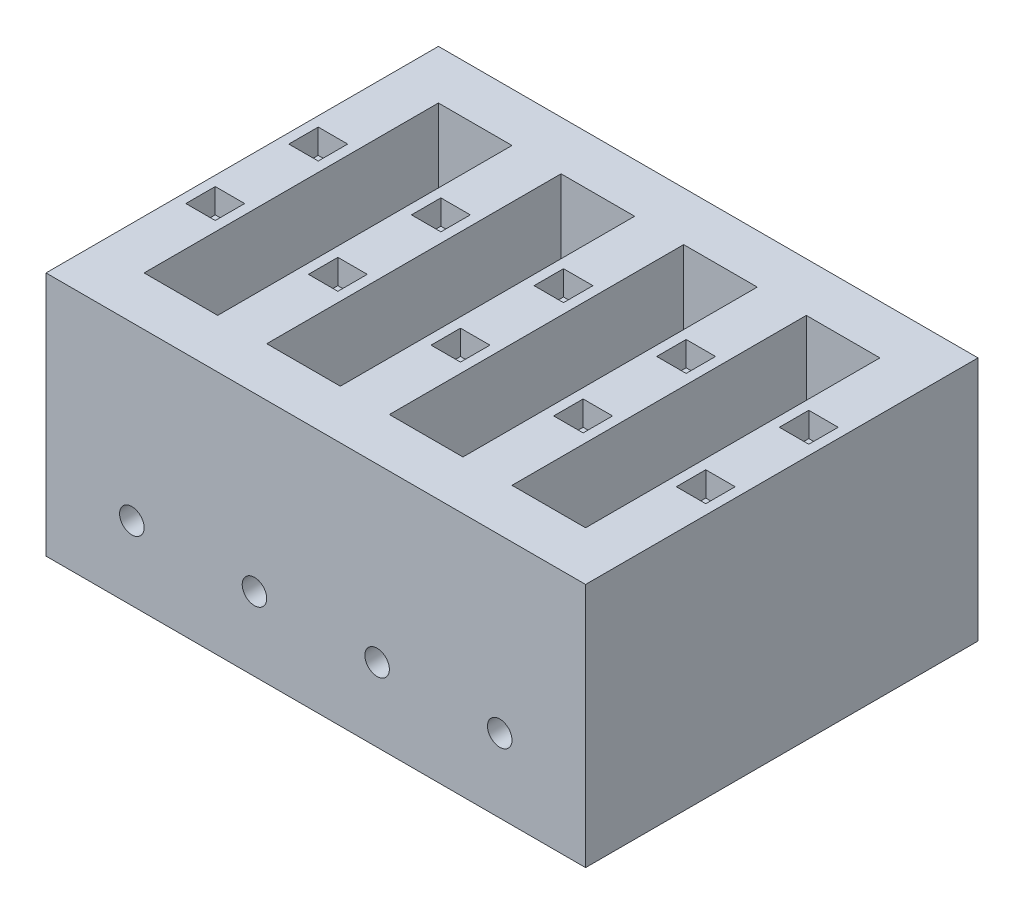
from build123d import *

# Parameters (mm, degrees)
SKETCH1_W           = 110
SKETCH1_H           = 50
BOSS_EXTRUDE1_DEPTH = 80
SKETCH2_W           = 15
SKETCH2_H           = 10
CUT_EXTRUDE1_DEPTH  = 40
SKETCH4_R           = 2.5
CUT_EXTRUDE2_DEPTH  = 10
SKETCH5_W           = 15
SKETCH5_H           = 40
CUT_EXTRUDE3_DEPTH  = 15
SKETCH6_W           = 6
SKETCH6_H           = 6
CUT_EXTRUDE4_DEPTH  = 5


with BuildPart() as part:
    # Sketch1 → Boss-Extrude1 (new body)
    with BuildSketch(Plane.XY):
        with Locations((55, 25)):
            Rectangle(SKETCH1_W, SKETCH1_H)
    extrude(amount=-BOSS_EXTRUDE1_DEPTH)

    # Sketch2 → Cut-Extrude1 (cut)
    with BuildSketch(Plane(origin=(0, 50, 0), x_dir=(1, 0, 0), z_dir=(0, 1, 0))):
        with Locations((17.5, 15)):
            Rectangle(SKETCH2_W, SKETCH2_H)
        with Locations((17.5, 65)):
            Rectangle(SKETCH2_W, SKETCH2_H)
        with Locations((42.5, 15)):
            Rectangle(SKETCH2_W, SKETCH2_H)
        with Locations((42.5, 65)):
            Rectangle(SKETCH2_W, SKETCH2_H)
        with Locations((67.5, 15)):
            Rectangle(SKETCH2_W, SKETCH2_H)
        with Locations((67.5, 65)):
            Rectangle(SKETCH2_W, SKETCH2_H)
        with Locations((92.5, 15)):
            Rectangle(SKETCH2_W, SKETCH2_H)
        with Locations((92.5, 65)):
            Rectangle(SKETCH2_W, SKETCH2_H)
    extrude(amount=-CUT_EXTRUDE1_DEPTH, mode=Mode.SUBTRACT)

    # Sketch4 → Cut-Extrude2 (cut)
    with BuildSketch(Plane.XY):
        with Locations((17.5, 15)):
            Circle(SKETCH4_R)
        with Locations((42.5, 15)):
            Circle(SKETCH4_R)
        with Locations((67.5, 15)):
            Circle(SKETCH4_R)
        with Locations((92.5, 15)):
            Circle(SKETCH4_R)
    cut_extrude2 = extrude(amount=-CUT_EXTRUDE2_DEPTH, mode=Mode.SUBTRACT)

    # Mirror1: Cut-Extrude2 across plane
    add(cut_extrude2.mirror(Plane.XY.offset(-40)), mode=Mode.SUBTRACT)

    # Sketch5 → Cut-Extrude3 (cut)
    with BuildSketch(Plane(origin=(0, 50, 0), x_dir=(1, 0, 0), z_dir=(0, 1, 0))):
        with Locations((42.5, 40)):
            Rectangle(SKETCH5_W, SKETCH5_H)
        with Locations((17.5, 40)):
            Rectangle(SKETCH5_W, SKETCH5_H)
        with Locations((67.5, 40)):
            Rectangle(SKETCH5_W, SKETCH5_H)
        with Locations((92.5, 40)):
            Rectangle(SKETCH5_W, SKETCH5_H)
    extrude(amount=-CUT_EXTRUDE3_DEPTH, mode=Mode.SUBTRACT)

    # Sketch6 → Cut-Extrude4 (cut)
    with BuildSketch(Plane(origin=(0, 50, 0), x_dir=(1, 0, 0), z_dir=(0, 1, 0))):
        with Locations((5, 50.5)):
            Rectangle(SKETCH6_W, SKETCH6_H)
        with Locations((30, 50.5)):
            Rectangle(SKETCH6_W, SKETCH6_H)
        with Locations((55, 50.5)):
            Rectangle(SKETCH6_W, SKETCH6_H)
        with Locations((80, 50.5)):
            Rectangle(SKETCH6_W, SKETCH6_H)
        with Locations((105, 50.5)):
            Rectangle(SKETCH6_W, SKETCH6_H)
        with Locations((30, 29.5)):
            Rectangle(SKETCH6_W, SKETCH6_H)
        with Locations((55, 29.5)):
            Rectangle(SKETCH6_W, SKETCH6_H)
        with Locations((80, 29.5)):
            Rectangle(SKETCH6_W, SKETCH6_H)
        with Locations((105, 29.5)):
            Rectangle(SKETCH6_W, SKETCH6_H)
        with Locations((5, 29.5)):
            Rectangle(SKETCH6_W, SKETCH6_H)
    extrude(amount=-CUT_EXTRUDE4_DEPTH, mode=Mode.SUBTRACT)


solid = part.part
